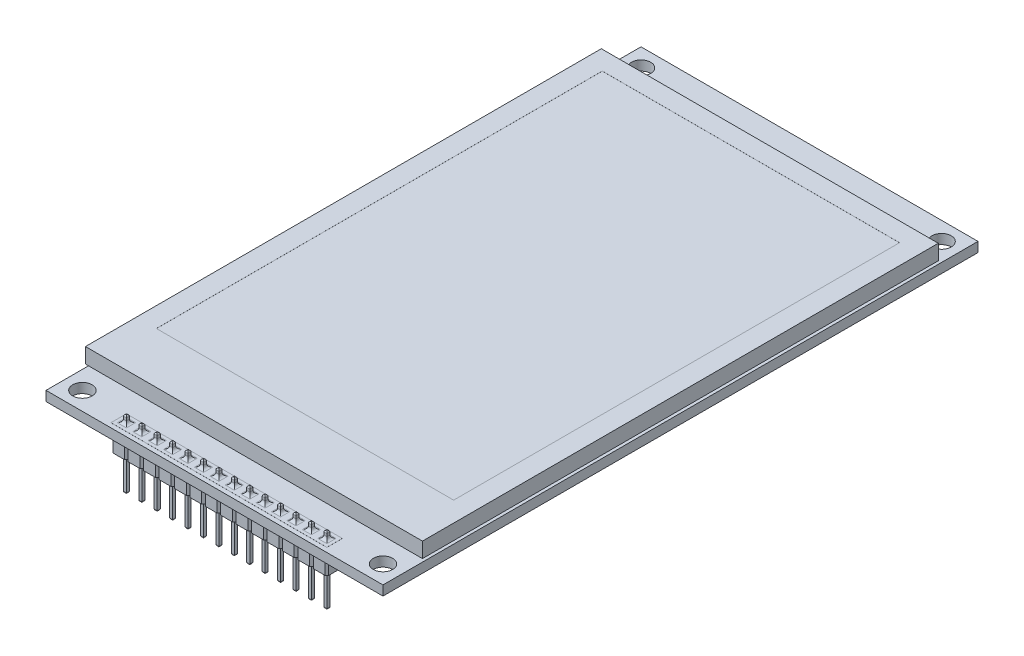
from build123d import *

# Parameters (mm, degrees)
SKETCH_1_W           = 55.5
SKETCH_1_H           = 98
SKETCH_1_R           = 1.6
SKETCH_1_W_2         = 35.56
SKETCH_1_H_2         = 2.54
EXTRUDE_1_DEPTH      = 1.6
EXTRUDE_START        = 0.01
SKETCH_2_W           = 35.56
SKETCH_2_H           = 2.54
EXTRUDE_2_DEPTH      = 1.62
EXTRUDE_3_DEPTH      = 1.18
EXTRUDE_3_DEPTH_BACK = 9.99
SKETCH_3_W           = 0.5
SKETCH_3_H           = 0.5
SKETCH_4_W           = 2.54
SKETCH_4_H           = 2.54
EXTRUDE_4_DEPTH      = 2.54
CHAMFER_1_SIZE       = 0.3
EXTRUDE_5_DEPTH      = 2.54
FILLET_1_R           = 0.5
FILLET_2_R           = 0.25
EXTRUDE_START_2      = 0.5
SKETCH_6_W           = 55.5
SKETCH_6_H           = 84.96
SKETCH_6_W_2         = 48.96
SKETCH_6_H_2         = 73.44
EXTRUDE_6_DEPTH      = 2.5
SKETCH_7_W           = 48.96
SKETCH_7_H           = 73.44
EXTRUDE_7_DEPTH      = 2.99
SKETCH_8_W           = 31.636815755
SKETCH_8_H           = 11.520409098
SKETCH_8_W_2         = 14.944622194
SKETCH_8_H_2         = 9.304945811
SKETCH_8_W_3         = 6.735008396
SKETCH_8_H_3         = 5.76020455
SKETCH_8_W_4         = 7.621193712
SKETCH_8_H_4         = 6.557771333
SKETCH_8_W_5         = 8.773234621
SKETCH_8_H_5         = 7.178101054
SKETCH_8_W_6         = 3.721978324
SKETCH_8_H_6         = 4.165070982
SKETCH_8_W_7         = 5.893132346
SKETCH_8_H_7         = 3.721978324
SKETCH_8_W_8         = 4.342308044
SKETCH_8_H_8         = 3.013030072
SKETCH_8_W_9         = 2.946566173
SKETCH_8_H_9         = 2.968720806
SKETCH_8_W_10        = 3.101648604
SKETCH_8_H_10        = 3.899215387
SKETCH_8_H_11        = 3.278885667
SKETCH_8_W_11        = 3.367504198
SKETCH_8_H_12        = 2.481318883
SKETCH_8_W_12        = 3.190267135
SKETCH_8_H_13        = 1
EXTRUDE_8_DEPTH      = 2.2


with BuildPart() as part:
    # 草图1 → 凸台-拉伸1 (new body)
    with BuildSketch(Plane(origin=(0, 0, 0), x_dir=(1, 0, 0), z_dir=(0, 1, 0))):
        with Locations((27.75, -49)):
            Rectangle(SKETCH_1_W, SKETCH_1_H)
        with Locations(Location((3, -3, 0), (0, 0, 270))):
            Circle(SKETCH_1_R, mode=Mode.SUBTRACT)
        with Locations(Location((52.5, -3, 0), (0, 0, 270))):
            Circle(SKETCH_1_R, mode=Mode.SUBTRACT)
        with Locations(Location((3, -95, 0), (0, 0, 270))):
            Circle(SKETCH_1_R, mode=Mode.SUBTRACT)
        with Locations(Location((52.5, -95, 0), (0, 0, 270))):
            Circle(SKETCH_1_R, mode=Mode.SUBTRACT)
        with Locations((27.75, -96)):
            Rectangle(SKETCH_1_W_2, SKETCH_1_H_2, mode=Mode.SUBTRACT)
    extrude(amount=EXTRUDE_1_DEPTH)

    # 草图2 → 凸台-拉伸2 (add)
    with BuildSketch(Plane(origin=(0, 1.6, 0), x_dir=(1, 0, 0), z_dir=(0, 1, 0)).offset(EXTRUDE_START)):
        with Locations((27.75, -96)):
            Rectangle(SKETCH_2_W, SKETCH_2_H)
    extrude(amount=-EXTRUDE_2_DEPTH)

    # 草图3 → 凸台-拉伸3 (add, two sides: drawn at the far end of the back side and taken through both)
    with BuildSketch(Plane(origin=(0, 1.61, 0), x_dir=(1, 0, 0), z_dir=(0, 1, 0)).offset(-EXTRUDE_3_DEPTH_BACK)):
        with Locations((13.78, -96)):
            Rectangle(SKETCH_3_W, SKETCH_3_H)
        with Locations((11.24, -96)):
            Rectangle(SKETCH_3_W, SKETCH_3_H)
        with Locations((16.32, -96)):
            Rectangle(SKETCH_3_W, SKETCH_3_H)
        with Locations((18.86, -96)):
            Rectangle(SKETCH_3_W, SKETCH_3_H)
        with Locations((21.4, -96)):
            Rectangle(SKETCH_3_W, SKETCH_3_H)
        with Locations((23.94, -96)):
            Rectangle(SKETCH_3_W, SKETCH_3_H)
        with Locations((26.48, -96)):
            Rectangle(SKETCH_3_W, SKETCH_3_H)
        with Locations((29.02, -96)):
            Rectangle(SKETCH_3_W, SKETCH_3_H)
        with Locations((31.56, -96)):
            Rectangle(SKETCH_3_W, SKETCH_3_H)
        with Locations((34.1, -96)):
            Rectangle(SKETCH_3_W, SKETCH_3_H)
        with Locations((36.64, -96)):
            Rectangle(SKETCH_3_W, SKETCH_3_H)
        with Locations((39.18, -96)):
            Rectangle(SKETCH_3_W, SKETCH_3_H)
        with Locations((41.72, -96)):
            Rectangle(SKETCH_3_W, SKETCH_3_H)
        with Locations((44.26, -96)):
            Rectangle(SKETCH_3_W, SKETCH_3_H)
    extrude(amount=EXTRUDE_3_DEPTH + EXTRUDE_3_DEPTH_BACK)

    # 草图4 → 凸台-拉伸4 (add)
    with BuildSketch(Plane.XZ.offset(0.01)):
        with Locations((11.24, 96)):
            Rectangle(SKETCH_4_W, SKETCH_4_H)
        with Locations((16.32, 96)):
            Rectangle(SKETCH_4_W, SKETCH_4_H)
        with Locations((21.4, 96)):
            Rectangle(SKETCH_4_W, SKETCH_4_H)
        with Locations((26.48, 96)):
            Rectangle(SKETCH_4_W, SKETCH_4_H)
        with Locations((31.56, 96)):
            Rectangle(SKETCH_4_W, SKETCH_4_H)
        with Locations((36.64, 96)):
            Rectangle(SKETCH_4_W, SKETCH_4_H)
        with Locations((41.72, 96)):
            Rectangle(SKETCH_4_W, SKETCH_4_H)
    extrude(amount=EXTRUDE_4_DEPTH)

    # 倒角1
    chamfer_1_edges = [part.edges().sort_by_distance(p)[0] for p in [
        (12.51, -1.28, 94.73),
        (12.51, -1.28, 97.27),
        (15.05, -1.28, 97.27),
        (15.05, -1.28, 94.73),
        (17.59, -1.28, 94.73),
        (17.59, -1.28, 97.27),
        (20.13, -1.28, 97.27),
        (20.13, -1.28, 94.73),
        (22.67, -1.28, 94.73),
        (22.67, -1.28, 97.27),
        (25.21, -1.28, 97.27),
        (25.21, -1.28, 94.73),
        (27.75, -1.28, 94.73),
        (27.75, -1.28, 97.27),
        (9.97, -1.275, 94.73),
        (30.29, -1.28, 97.27),
        (30.29, -1.28, 94.73),
        (32.83, -1.28, 94.73),
        (32.83, -1.28, 97.27),
        (9.97, -1.275, 97.27),
        (35.37, -1.28, 97.27),
        (35.37, -1.28, 94.73),
        (37.91, -1.28, 94.73),
        (37.91, -1.28, 97.27),
        (40.45, -1.28, 97.27),
        (40.45, -1.28, 94.73),
        (42.99, -1.28, 94.73),
        (42.99, -1.28, 97.27),
    ]]
    chamfer(chamfer_1_edges, length=CHAMFER_1_SIZE)

    # 草图5 → 凸台-拉伸5 (add)
    with BuildSketch(Plane.XZ.offset(0.01)):
        Polygon((12.51, 96.97), (12.81, 97.27), (14.75, 97.27), (15.05, 96.97), (15.05, 95.03), (14.75, 94.73), (12.81, 94.73), (12.51, 95.03), align=None)
        Polygon((17.59, 96.97), (17.89, 97.27), (19.83, 97.27), (20.13, 96.97), (20.13, 95.03), (19.83, 94.73), (17.89, 94.73), (17.59, 95.03), align=None)
        Polygon((22.67, 96.97), (22.97, 97.27), (24.91, 97.27), (25.21, 96.97), (25.21, 95.03), (24.91, 94.73), (22.97, 94.73), (22.67, 95.03), align=None)
        Polygon((27.75, 96.97), (28.05, 97.27), (29.99, 97.27), (30.29, 96.97), (30.29, 95.03), (29.99, 94.73), (28.05, 94.73), (27.75, 95.03), align=None)
        Polygon((32.83, 96.97), (33.13, 97.27), (35.07, 97.27), (35.37, 96.97), (35.37, 95.03), (35.07, 94.73), (33.13, 94.73), (32.83, 95.03), align=None)
        Polygon((37.91, 96.97), (38.21, 97.27), (40.15, 97.27), (40.45, 96.97), (40.45, 95.03), (40.15, 94.73), (38.21, 94.73), (37.91, 95.03), align=None)
        Polygon((42.99, 96.97), (43.29, 97.27), (45.23, 97.27), (45.53, 96.97), (45.53, 95.03), (45.23, 94.73), (43.29, 94.73), (42.99, 95.03), align=None)
    extrude(amount=EXTRUDE_5_DEPTH)

    # 圆角1
    fillet_1_edges = [part.edges().sort_by_distance(p)[0] for p in [
        (16.32, 1.61, 95.75),
        (16.07, 1.61, 96),
        (16.32, 1.61, 96.25),
        (16.57, 1.61, 96),
        (18.86, 1.61, 95.75),
        (18.61, 1.61, 96),
        (18.86, 1.61, 96.25),
        (19.11, 1.61, 96),
        (21.4, 1.61, 95.75),
        (21.15, 1.61, 96),
        (21.4, 1.61, 96.25),
        (21.65, 1.61, 96),
        (23.94, 1.61, 95.75),
        (23.69, 1.61, 96),
        (23.94, 1.61, 96.25),
        (24.19, 1.61, 96),
        (26.48, 1.61, 95.75),
        (26.23, 1.61, 96),
        (26.48, 1.61, 96.25),
        (26.73, 1.61, 96),
        (29.02, 1.61, 95.75),
        (28.77, 1.61, 96),
        (29.02, 1.61, 96.25),
        (29.27, 1.61, 96),
        (31.56, 1.61, 95.75),
        (31.31, 1.61, 96),
        (31.56, 1.61, 96.25),
        (31.81, 1.61, 96),
        (34.1, 1.61, 95.75),
        (33.85, 1.61, 96),
        (34.1, 1.61, 96.25),
        (34.35, 1.61, 96),
        (36.64, 1.61, 95.75),
        (36.39, 1.61, 96),
        (36.64, 1.61, 96.25),
        (36.89, 1.61, 96),
        (39.18, 1.61, 95.75),
        (38.93, 1.61, 96),
        (39.18, 1.61, 96.25),
        (39.43, 1.61, 96),
        (41.72, 1.61, 95.75),
        (41.47, 1.61, 96),
        (41.72, 1.61, 96.25),
        (41.97, 1.61, 96),
        (44.26, 1.61, 95.75),
        (44.01, 1.61, 96),
        (44.26, 1.61, 96.25),
        (44.51, 1.61, 96),
        (11.24, 1.61, 95.75),
        (10.99, 1.61, 96),
        (11.24, 1.61, 96.25),
        (11.49, 1.61, 96),
        (13.78, 1.61, 95.75),
        (13.53, 1.61, 96),
        (13.78, 1.61, 96.25),
        (14.03, 1.61, 96),
    ]]
    fillet(fillet_1_edges, radius=FILLET_1_R)

    # 圆角2
    fillet_2_edges = [part.edges().sort_by_distance(p)[0] for p in [
        (16.57, -8.38, 96),
        (16.32, -8.38, 96.25),
        (16.07, -8.38, 96),
        (16.32, -8.38, 95.75),
        (16.57, 2.79, 96),
        (16.32, 2.79, 95.75),
        (16.07, 2.79, 96),
        (16.32, 2.79, 96.25),
        (19.11, -8.38, 96),
        (18.86, -8.38, 96.25),
        (18.61, -8.38, 96),
        (18.86, -8.38, 95.75),
        (19.11, 2.79, 96),
        (18.86, 2.79, 95.75),
        (18.61, 2.79, 96),
        (18.86, 2.79, 96.25),
        (21.65, -8.38, 96),
        (21.4, -8.38, 96.25),
        (21.15, -8.38, 96),
        (21.4, -8.38, 95.75),
        (21.65, 2.79, 96),
        (21.4, 2.79, 95.75),
        (21.15, 2.79, 96),
        (21.4, 2.79, 96.25),
        (24.19, -8.38, 96),
        (23.94, -8.38, 96.25),
        (23.69, -8.38, 96),
        (23.94, -8.38, 95.75),
        (24.19, 2.79, 96),
        (23.94, 2.79, 95.75),
        (23.69, 2.79, 96),
        (23.94, 2.79, 96.25),
        (26.73, -8.38, 96),
        (26.48, -8.38, 96.25),
        (26.23, -8.38, 96),
        (26.48, -8.38, 95.75),
        (26.73, 2.79, 96),
        (26.48, 2.79, 95.75),
        (26.23, 2.79, 96),
        (26.48, 2.79, 96.25),
        (29.27, -8.38, 96),
        (29.02, -8.38, 96.25),
        (28.77, -8.38, 96),
        (29.02, -8.38, 95.75),
        (29.27, 2.79, 96),
        (29.02, 2.79, 95.75),
        (28.77, 2.79, 96),
        (29.02, 2.79, 96.25),
        (31.81, -8.38, 96),
        (31.56, -8.38, 96.25),
        (31.31, -8.38, 96),
        (31.56, -8.38, 95.75),
        (31.81, 2.79, 96),
        (31.56, 2.79, 95.75),
        (31.31, 2.79, 96),
        (31.56, 2.79, 96.25),
        (34.35, -8.38, 96),
        (34.1, -8.38, 96.25),
        (33.85, -8.38, 96),
        (34.1, -8.38, 95.75),
        (34.35, 2.79, 96),
        (34.1, 2.79, 95.75),
        (33.85, 2.79, 96),
        (34.1, 2.79, 96.25),
        (36.89, -8.38, 96),
        (36.64, -8.38, 96.25),
        (36.39, -8.38, 96),
        (36.64, -8.38, 95.75),
        (36.89, 2.79, 96),
        (36.64, 2.79, 95.75),
        (36.39, 2.79, 96),
        (36.64, 2.79, 96.25),
        (39.43, -8.38, 96),
        (39.18, -8.38, 96.25),
        (38.93, -8.38, 96),
        (39.18, -8.38, 95.75),
        (39.43, 2.79, 96),
        (39.18, 2.79, 95.75),
        (38.93, 2.79, 96),
        (39.18, 2.79, 96.25),
        (41.97, -8.38, 96),
        (41.72, -8.38, 96.25),
        (41.47, -8.38, 96),
        (41.72, -8.38, 95.75),
        (41.97, 2.79, 96),
        (41.72, 2.79, 95.75),
        (41.47, 2.79, 96),
        (41.72, 2.79, 96.25),
        (44.51, -8.38, 96),
        (44.26, -8.38, 96.25),
        (44.01, -8.38, 96),
        (44.26, -8.38, 95.75),
        (44.51, 2.79, 96),
        (44.26, 2.79, 95.75),
        (44.01, 2.79, 96),
        (44.26, 2.79, 96.25),
        (11.49, -8.38, 96),
        (11.24, -8.38, 96.25),
        (10.99, -8.38, 96),
        (11.24, -8.38, 95.75),
        (11.49, 2.79, 96),
        (11.24, 2.79, 95.75),
        (10.99, 2.79, 96),
        (11.24, 2.79, 96.25),
        (14.03, -8.38, 96),
        (13.78, -8.38, 96.25),
        (13.53, -8.38, 96),
        (13.78, -8.38, 95.75),
        (14.03, 2.79, 96),
        (13.78, 2.79, 95.75),
        (13.53, 2.79, 96),
        (13.78, 2.79, 96.25),
    ]]
    fillet(fillet_2_edges, radius=FILLET_2_R - 0.0001)  # a hair under: the kernel refuses the full size



with BuildPart() as body_2:
    # 草图6 → 凸台-拉伸6 (new body)
    with BuildSketch(Plane(origin=(0, 1.6, 0), x_dir=(1, 0, 0), z_dir=(0, 1, 0)).offset(EXTRUDE_START_2)):
        with Locations((27.75, -49.02)):
            Rectangle(SKETCH_6_W, SKETCH_6_H)
        with Locations((27.75, -46.37)):
            Rectangle(SKETCH_6_W_2, SKETCH_6_H_2, mode=Mode.SUBTRACT)
    extrude(amount=EXTRUDE_6_DEPTH)


with BuildPart() as part_1:
    add(part.part)

    add(body_2.part)  # 凸台-拉伸7 merges body 2
    # 草图7 → 凸台-拉伸7 (add)
    with BuildSketch(Plane(origin=(0, 1.6, 0), x_dir=(1, 0, 0), z_dir=(0, 1, 0))):
        with Locations((27.75, -46.37)):
            Rectangle(SKETCH_7_W, SKETCH_7_H)
    extrude(amount=EXTRUDE_7_DEPTH)

    # 草图8 → 凸台-拉伸8 (add)
    with BuildSketch(Plane.XZ):
        with Locations((30.763030072, 76.693291102)):
            Rectangle(SKETCH_8_W, SKETCH_8_H)
        with Locations((7.472311097, 47.050392307)):
            Rectangle(SKETCH_8_W_2, SKETCH_8_H_2)
        with Locations((39.04886277, 52.544741261)):
            Rectangle(SKETCH_8_W_3, SKETCH_8_H_3)
        with Locations((25.13575332, 26.712439321)):
            Rectangle(SKETCH_8_W_4, SKETCH_8_H_4)
        with Locations((42.194820639, 24.807140893)):
            Rectangle(SKETCH_8_W_5, SKETCH_8_H_5)
        with Locations((48.974138301, 34.46656083)):
            Rectangle(SKETCH_8_W_6, SKETCH_8_H_6)
        with Locations((33.709596245, 38.410085483)):
            Rectangle(SKETCH_8_W_7, SKETCH_8_H_7)
        with Locations((41.220016792, 41.777589681)):
            Rectangle(SKETCH_8_W_8, SKETCH_8_H_8)
        with Locations((32.236313159, 45.566031903)):
            Rectangle(SKETCH_8_W_9, SKETCH_8_H_9)
        with Locations((14.279983208, 24.762831627)):
            Rectangle(SKETCH_8_W_10, SKETCH_8_H_10)
        with Locations((25.13575332, 16.920091588)):
            Rectangle(SKETCH_8_W_4, SKETCH_8_H_11)
        with Locations((37.365110671, 16.521308196)):
            Rectangle(SKETCH_8_W_11, SKETCH_8_H_12)
        with Locations((48.176571517, 17.021308196)):
            Rectangle(SKETCH_8_W_12, SKETCH_8_H_13)
    extrude(amount=EXTRUDE_8_DEPTH)


solid = part_1.part
